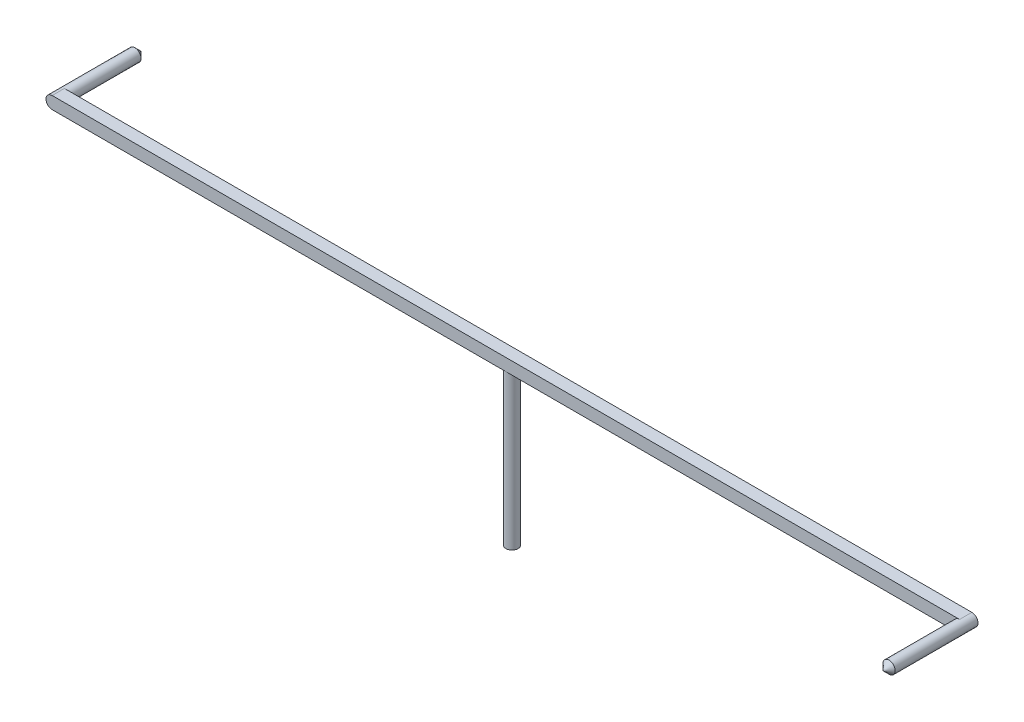
from build123d import *

# Parameters (mm, degrees)
SKETCH_1_R      = 0.4
EXTRUDE_1_DEPTH = 10
SKETCH_2_W      = 60
SKETCH_2_H      = 0.8
EXTRUDE_2_DEPTH = 0.8
FILLET_1_R      = 0.4
SKETCH_3_R      = 0.4
EXTRUDE_3_DEPTH = 5
SKETCH_4_R      = 0.4
EXTRUDE_4_DEPTH = 5
CHAMFER_1_SIZE  = 0.4


with BuildPart() as part:
    # 草图1 → 凸台-拉伸1 (new body)
    with BuildSketch(Plane(origin=(0, 0, 0), x_dir=(1, 0, 0), z_dir=(0, 1, 0))):
        with Locations(Location((0, 0, 0), (0, 0, 270))):
            Circle(SKETCH_1_R)
    extrude(amount=EXTRUDE_1_DEPTH)

    # 草图2 → 凸台-拉伸2 (add)
    with BuildSketch(Plane(origin=(0, 10, 0), x_dir=(1, 0, 0), z_dir=(0, 1, 0))):
        Rectangle(SKETCH_2_W, SKETCH_2_H)
    extrude(amount=EXTRUDE_2_DEPTH)

    # 圆角1
    fillet_1_edges = [part.edges().sort_by_distance(p)[0] for p in [
        (30, 10, 0),
        (30, 10.8, 0),
        (-30, 10, 0),
        (-30, 10.8, 0),
    ]]
    fillet(fillet_1_edges, radius=FILLET_1_R - 0.0001)  # a hair under: the kernel refuses the full size

    # 草图3 → 凸台-拉伸3 (add)
    with BuildSketch(Plane.XY.offset(0.4)):
        with Locations((29.6, 10.4)):
            Circle(SKETCH_3_R)
    extrude(amount=EXTRUDE_3_DEPTH)

    # 草图4 → 凸台-拉伸4 (add)
    with BuildSketch(Plane(origin=(0, 0, -0.4), x_dir=(-1, 0, 0), z_dir=(0, 0, -1))):
        with Locations((29.6, 10.4)):
            Circle(SKETCH_4_R)
    extrude(amount=EXTRUDE_4_DEPTH)

    # 倒角1
    chamfer_1_edges = [part.edges().sort_by_distance(p)[0] for p in [
        (29.2, 10.4, 5.4),
        (-29.2, 10.4, -5.4),
    ]]
    chamfer(chamfer_1_edges, length=CHAMFER_1_SIZE)


solid = part.part
